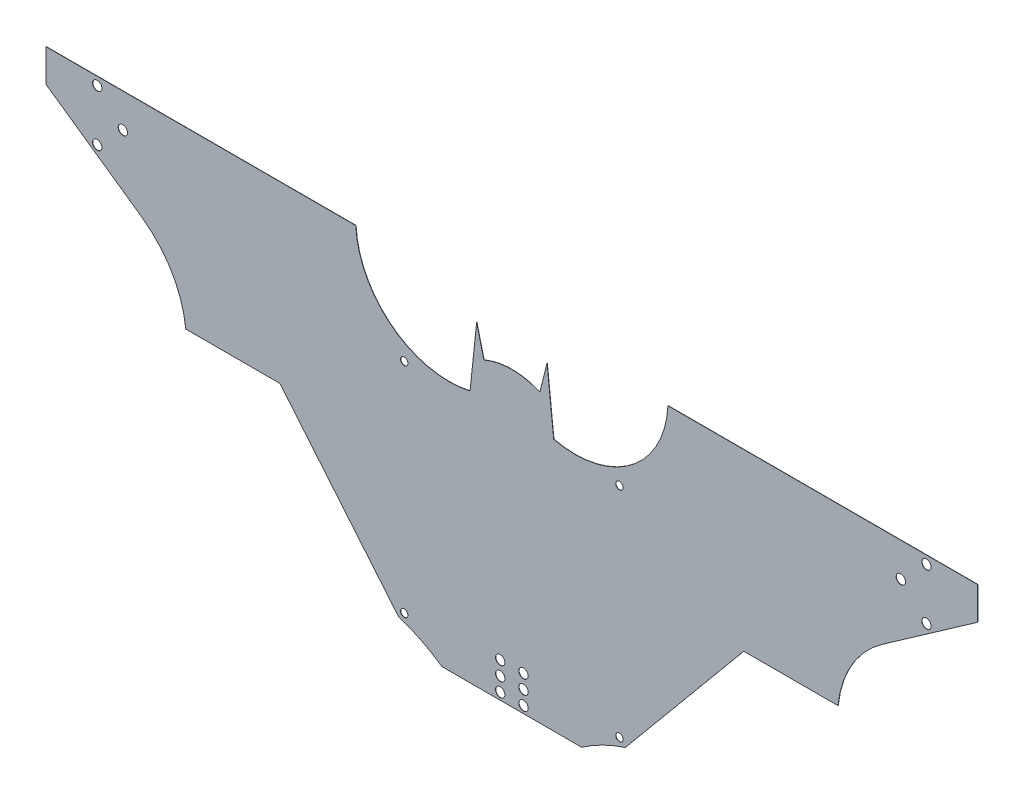
from build123d import *
from OCP.BRepFilletAPI import BRepFilletAPI_MakeChamfer

# Parameters (mm, degrees)
SKETCH2_R           = 1.5875
BOSS_EXTRUDE1_DEPTH = 0.118
SKETCH3_R           = 2
CUT_EXTRUDE1_DEPTH  = 267.27056526
CHAMFER1_SIZE       = 20
CHAMFER1_SIZE2      = 24.415491775
SKETCH4_W           = 60
SKETCH4_H           = 115.138092234
CUT_EXTRUDE2_DEPTH  = 251.000027848
SKETCH5_R           = 2
CUT_EXTRUDE3_DEPTH  = 221.325883998
LPATTERN1_COUNT     = 3
LPATTERN1_PITCH     = 6


with BuildPart() as part:
    # Sketch2 → Boss-Extrude1 (new body)
    with BuildSketch(Plane.XY):
        with BuildLine():
            Line((99.563224144, -21.926473835), (48.69, -83.15))
            ThreePointArc((48.69, -83.15), (13.462751156, -108.648946204), (0, -150))
            ThreePointArc((0, -150), (-13.462751156, -108.648946204), (-48.69, -83.15))
            Line((-48.69, -83.15), (-99.563224144, -21.926473835))
            Line((-99.563224144, -21.926473835), (-140, -21.926473835))
            ThreePointArc((-140, -21.926473835), (-145.965681261, -3.736597624), (-158.952536164, 10.327631798))
            Line((-158.952536164, 10.327631798), (-220, 53.073526165))
            Line((-220, 53.073526165), (-67, 53.073526165))
            ThreePointArc((-67, 53.073526165), (-51.137889855, 23.094319589), (-17.95554779, 16.073526165))
            Line((-17.95554779, 16.073526165), (-15.117733438, 43.073526165))
            Line((-15.117733438, 43.073526165), (-12, 30.568980335))
            ThreePointArc((-12, 30.568980335), (0, 33.073526165), (12, 30.568980335))
            Line((12, 30.568980335), (15.117733438, 43.073526165))
            Line((15.117733438, 43.073526165), (17.95554779, 16.073526165))
            ThreePointArc((17.95554779, 16.073526165), (51.137889855, 23.094319589), (67, 53.073526165))
            Line((67, 53.073526165), (220, 53.073526165))
            Line((220, 53.073526165), (158.952536164, 10.327631798))
            ThreePointArc((158.952536164, 10.327631798), (145.965681261, -3.736597624), (140, -21.926473835))
            Line((140, -21.926473835), (99.563224144, -21.926473835))
        make_face()
        with Locations((46.19, 13)):
            Circle(SKETCH2_R, mode=Mode.SUBTRACT)
        with Locations((-46.19, 13)):
            Circle(SKETCH2_R, mode=Mode.SUBTRACT)
        with Locations((46.19, -80.65)):
            Circle(SKETCH2_R, mode=Mode.SUBTRACT)
        with Locations((-46.19, -80.65)):
            Circle(SKETCH2_R, mode=Mode.SUBTRACT)
    extrude(amount=BOSS_EXTRUDE1_DEPTH)

    # Sketch3 → Cut-Extrude1 (cut, through all)
    with BuildSketch(Plane(origin=(0, 0, 0), x_dir=(-1, 0, 0), z_dir=(0, 0, -1))):
        with Locations((178, 49.573526165)):
            Circle(SKETCH3_R)
        with Locations((178, 27.573526165)):
            Circle(SKETCH3_R)
        with Locations((167, 38.573526165)):
            Circle(SKETCH3_R)
    cut_extrude1 = extrude(amount=-CUT_EXTRUDE1_DEPTH, mode=Mode.SUBTRACT)

    # Mirror2: Cut-Extrude1 across plane
    add(cut_extrude1.mirror(Plane(origin=(0, 0, 0), x_dir=(0, 0, 1), z_dir=(1, 0, 0))), mode=Mode.SUBTRACT)

    # Chamfer1: one chamfer whose edges measure the first distance from different faces: ONE call of the kernel's chamfer builder (chamfer() names one face for all edges)
    chamfer1_edges_1 = [part.edges().sort_by_distance(p)[0] for p in [
        (-220, 53.073526165, 0.059),
    ]]
    chamfer1_side_1 = [part.faces().sort_by_distance(p)[0] for p in [
        (-143.5, 53.073526165, 0.059),
    ]]
    chamfer1_edges_2 = [part.edges().sort_by_distance(p)[0] for p in [
        (220, 53.073526165, 0.059),
    ]]
    chamfer1_side_2 = [part.faces().sort_by_distance(p)[0] for p in [
        (143.5, 53.073526165, 0.059),
    ]]
    chamfer1 = BRepFilletAPI_MakeChamfer(part.part.solid().wrapped)
    for e in chamfer1_edges_1:
        chamfer1.Add(CHAMFER1_SIZE, CHAMFER1_SIZE2, e.wrapped, chamfer1_side_1[0].wrapped)  # the first distance lies on this face
    for e in chamfer1_edges_2:
        chamfer1.Add(CHAMFER1_SIZE, CHAMFER1_SIZE2, e.wrapped, chamfer1_side_2[0].wrapped)  # the first distance lies on this face
    add(Compound.cast(chamfer1.Shape()), mode=Mode.REPLACE)

    # Sketch4 → Cut-Extrude2 (cut, through all)
    with BuildSketch(Plane(origin=(0, 0, 0), x_dir=(-1, 0, 0), z_dir=(0, 0, -1))):
        with Locations((0, -150)):
            Rectangle(SKETCH4_W, SKETCH4_H)
    extrude(amount=-CUT_EXTRUDE2_DEPTH, mode=Mode.SUBTRACT)

    # Sketch5 → Cut-Extrude3 (cut, through all)
    with BuildSketch(Plane(origin=(0, 0, 0), x_dir=(-1, 0, 0), z_dir=(0, 0, -1))):
        with Locations((-5, -89.430953883)):
            Circle(SKETCH5_R)
        with Locations((5, -89.430953883)):
            Circle(SKETCH5_R)
    cut_extrude3 = extrude(amount=-CUT_EXTRUDE3_DEPTH, mode=Mode.SUBTRACT)

    # LPattern1: Cut-Extrude3 ×3
    with Locations(*[(0, i * LPATTERN1_PITCH, 0) for i in range(1, LPATTERN1_COUNT)]):
        add(cut_extrude3, mode=Mode.SUBTRACT)


solid = part.part
